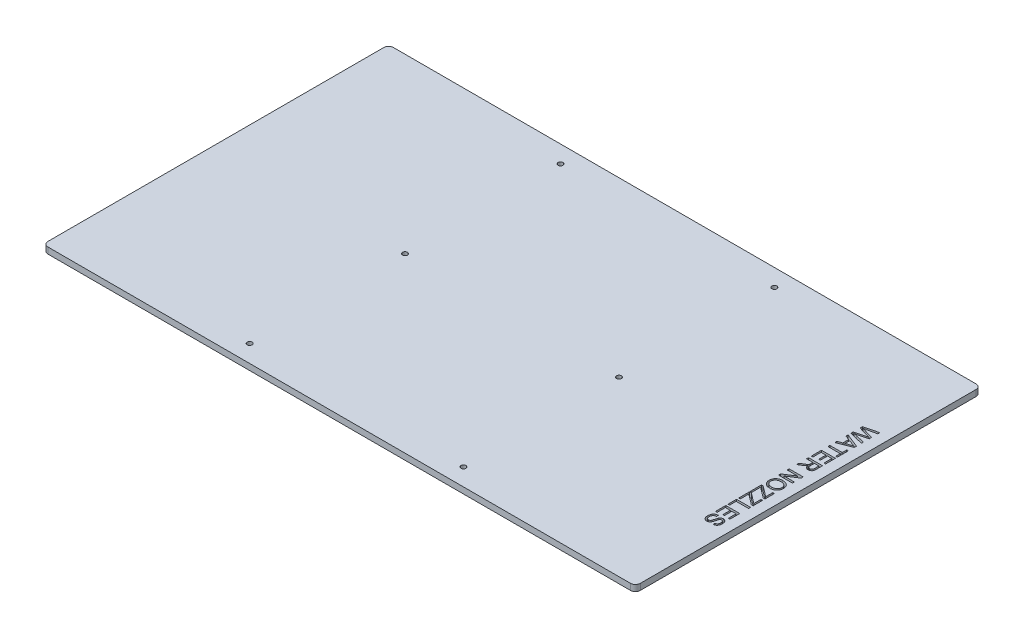
from build123d import *

# Parameters (mm, degrees)
SKETCH1_W           = 304.8
SKETCH1_H           = 177.8
SKETCH1_R           = 1.27
BOSS_EXTRUDE1_DEPTH = 3.175
CUT_EXTRUDE1_DEPTH  = 2.54
FILLET1_R           = 2.54


with BuildPart() as part:
    # Sketch1 → Boss-Extrude1 (new body)
    with BuildSketch(Plane(origin=(0, 0, 0), x_dir=(1, 0, 0), z_dir=(0, 1, 0))):
        Rectangle(SKETCH1_W, SKETCH1_H)
        with Locations((-55.0291, 80.01)):
            Circle(SKETCH1_R, mode=Mode.SUBTRACT)
        with Locations((-55.033333333, 0)):
            Circle(SKETCH1_R, mode=Mode.SUBTRACT)
        with Locations((-55.0291, -80.01)):
            Circle(SKETCH1_R, mode=Mode.SUBTRACT)
        with Locations((55.0291, -80.01)):
            Circle(SKETCH1_R, mode=Mode.SUBTRACT)
        with Locations((55.033333333, 0)):
            Circle(SKETCH1_R, mode=Mode.SUBTRACT)
        with Locations((55.0291, 80.01)):
            Circle(SKETCH1_R, mode=Mode.SUBTRACT)
    extrude(amount=BOSS_EXTRUDE1_DEPTH)

    # Sketch2 → Cut-Extrude1 (cut)
    # profile 1 of 12: a face of its own
    with BuildSketch(Plane(origin=(0, 3.175, 0), x_dir=(1, 0, 0), z_dir=(0, 1, 0))):
        with BuildLine():
            Line((139.7, 40.599397314), (146.891292318, 42.410185463))
            Line((146.891292318, 42.410185463), (146.891292318, 41.362895897))
            Line((146.891292318, 41.362895897), (142.161922791, 40.295438444))
            add(Edge.make_bspline(
                [(142.161922791, 40.295438444), (141.918010101, 40.240116159), (141.43267487, 40.130036385), (140.947069932, 40.021152573), (140.705513229, 39.966989996)],
                knots=[0, 0, 0, 0, 1.00513078, 2, 2, 2, 2], degree=3))
            add(Edge.make_bspline(
                [(140.705513229, 39.966989996), (140.792371041, 39.941345716), (140.956342762, 39.892933987), (141.188788479, 39.827490711), (141.391660637, 39.768050681), (141.565904996, 39.717410826), (141.711766359, 39.676407931), (141.82745239, 39.641006497), (141.915228597, 39.616877322), (141.963619911, 39.602578329), (141.983292933, 39.596765212)],
                knots=[0, 0, 0, 0, 1.633809233, 3.084334118, 4.356383392, 5.447555203, 6.357852567, 7.089694452, 7.629924063, 8, 8, 8, 8], degree=3))
            Line((141.983292933, 39.596765212), (146.891292318, 38.176369734))
            Line((146.891292318, 38.176369734), (146.891292318, 36.956212564))
            Line((146.891292318, 36.956212564), (143.288443342, 35.929090885))
            add(Edge.make_bspline(
                [(143.288443342, 35.929090885), (143.065873463, 35.872408071), (142.627013829, 35.760641828), (141.973316149, 35.612142336), (141.335477306, 35.475082051), (140.913616359, 35.396132754), (140.705513229, 35.357187229)],
                knots=[0, 0, 0, 0, 1.04154457, 2.053700482, 3.039894486, 4, 4, 4, 4], degree=3))
            add(Edge.make_bspline(
                [(140.705513229, 35.357187229), (140.812108286, 35.333148364), (141.036323517, 35.282584298), (141.390339814, 35.203396852), (141.778206423, 35.11544733), (142.048588999, 35.054626897), (142.189293495, 35.022976528)],
                knots=[0, 0, 0, 0, 0.862132589, 1.813435466, 2.862132822, 4, 4, 4, 4], degree=3))
            Line((142.189293495, 35.022976528), (146.891292318, 33.961281328))
            Line((146.891292318, 33.961281328), (146.891292318, 32.913991762))
            Line((146.891292318, 32.913991762), (139.7, 34.726220475))
            Line((139.7, 34.726220475), (139.7, 35.841216519))
            Line((139.7, 35.841216519), (145.195749237, 37.343724109))
            add(Edge.make_bspline(
                [(145.195749237, 37.343724109), (145.249475294, 37.35881145), (145.351534795, 37.387471778), (145.497177163, 37.425038757), (145.625263633, 37.462292796), (145.737449513, 37.491924711), (145.832604318, 37.517568652), (145.910449451, 37.540277459), (145.972508465, 37.554883152), (146.007780963, 37.565445312), (146.022632609, 37.569892557)],
                knots=[0, 0, 0, 0, 1.562239628, 2.967673567, 4.210417925, 5.296319877, 6.215971374, 6.969386481, 7.566055473, 8, 8, 8, 8], degree=3))
            add(Edge.make_bspline(
                [(146.022632609, 37.569892557), (145.928450634, 37.596558009), (145.750492988, 37.646942608), (145.499965869, 37.721559871), (145.2796766, 37.784171595), (145.143390879, 37.823850077), (145.080504168, 37.842159033)],
                knots=[0, 0, 0, 0, 1.197730334, 2.263121701, 3.198547257, 4, 4, 4, 4], degree=3))
            Line((145.080504168, 37.842159033), (139.7, 39.399408031))
            Line((139.7, 39.399408031), (139.7, 40.599397314))
        make_face()
    # profile 2 of 12: a face of its own
    with BuildSketch(Plane(origin=(0, 3.175, 0), x_dir=(1, 0, 0), z_dir=(0, 1, 0))):
        Polygon((139.7, 33.252524153), (146.891292318, 30.397327563), (146.891292318, 29.253520252), (139.7, 26.398323662), (139.7, 27.474424496), (141.912705329, 28.292664487), (141.912705329, 31.358183328), (139.7, 32.176423319), align=None)
        with BuildLine():
            Line((142.742469827, 31.052783894), (142.742469827, 28.598063921))
            Line((142.742469827, 28.598063921), (144.632488962, 29.296737152))
            add(Edge.make_bspline(
                [(144.632488962, 29.296737152), (144.705516725, 29.32352179), (144.848299792, 29.375890813), (145.055751534, 29.453988804), (145.252756224, 29.52533787), (145.436489095, 29.595301488), (145.609619053, 29.658458896), (145.770976683, 29.716672698), (145.919440472, 29.774245656), (146.015363377, 29.808795999), (146.06152782, 29.825423907)],
                knots=[0, 0, 0, 0, 1.225184869, 2.395467751, 3.491410812, 4.525364584, 5.492066482, 6.394148129, 7.227157926, 8, 8, 8, 8], degree=3))
            add(Edge.make_bspline(
                [(146.06152782, 29.825423907), (145.947690369, 29.852929678), (145.71954608, 29.908054634), (145.385284092, 30.02347287), (145.05407908, 30.155507323), (144.840652831, 30.262735032), (144.733328397, 30.316656015)],
                knots=[0, 0, 0, 0, 0.9891762, 1.982431084, 2.985436691, 4, 4, 4, 4], degree=3))
            Line((144.733328397, 30.316656015), (142.742469827, 31.052783894))
        make_face(mode=Mode.SUBTRACT)
    # profile 3 of 12: a face of its own
    with BuildSketch(Plane(origin=(0, 3.175, 0), x_dir=(1, 0, 0), z_dir=(0, 1, 0))):
        Polygon((139.7, 23.878778337), (146.06152782, 23.878778337), (146.06152782, 26.183679721), (146.891292318, 26.183679721), (146.891292318, 20.559720344), (146.06152782, 20.559720344), (146.06152782, 22.864621728), (139.7, 22.864621728), align=None)
    # profile 4 of 12: a face of its own
    with BuildSketch(Plane(origin=(0, 3.175, 0), x_dir=(1, 0, 0), z_dir=(0, 1, 0))):
        Polygon((139.7, 19.545563735), (146.891292318, 19.545563735), (146.891292318, 14.474780691), (146.06152782, 14.474780691), (146.06152782, 18.531407126), (143.848822491, 18.531407126), (143.848822491, 14.751368857), (143.019057993, 14.751368857), (143.019057993, 18.531407126), (140.529764498, 18.531407126), (140.529764498, 14.29038858), (139.7, 14.29038858), align=None)
    # profile 5 of 12: a face of its own
    with BuildSketch(Plane(origin=(0, 3.175, 0), x_dir=(1, 0, 0), z_dir=(0, 1, 0))):
        with BuildLine():
            Line((139.7, 12.90744775), (146.891292318, 12.90744775))
            Line((146.891292318, 12.90744775), (146.891292318, 9.787187501))
            add(Edge.make_bspline(
                [(146.891292318, 9.787187501), (146.890719358, 9.713714577), (146.88961046, 9.571516331), (146.881686545, 9.365305218), (146.864852182, 9.173282605), (146.846050259, 8.99423828), (146.818288848, 8.828478621), (146.785719716, 8.675924614), (146.747226755, 8.537161395), (146.70172659, 8.41113294), (146.65026646, 8.294196999), (146.586739284, 8.185835298), (146.517241888, 8.081403532), (146.434932223, 7.98503292), (146.346427046, 7.89250504), (146.247351056, 7.806981757), (146.139103449, 7.728045686), (145.984348252, 7.630645623), (145.777192572, 7.528158567), (145.513452672, 7.440686114), (145.236989629, 7.384760592), (145.048120631, 7.378739403), (144.952294029, 7.375684428)],
                knots=[0, 0, 0, 0, 1.242122331, 2.403982386, 3.487329914, 4.500326623, 5.446523787, 6.327028739, 7.136568587, 7.878666205, 8.590811102, 9.292609518, 9.999600102, 10.708452415, 11.431798422, 12.162621657, 12.917616336, 13.694634159, 15.252079616, 16.810286496, 18.381632726, 20, 20, 20, 20], degree=3))
            add(Edge.make_bspline(
                [(144.952294029, 7.375684428), (144.890778569, 7.37709165), (144.769281319, 7.379871008), (144.590647648, 7.401160869), (144.419971093, 7.439683966), (144.255753461, 7.48907958), (144.100333994, 7.556697048), (143.950491545, 7.63499364), (143.810516278, 7.732126935), (143.675747631, 7.84058847), (143.552200949, 7.966682451), (143.438215685, 8.107045246), (143.339735409, 8.265209511), (143.25123324, 8.438264749), (143.173787754, 8.626524977), (143.10867237, 8.83124209), (143.057693754, 9.051691208), (143.032157635, 9.204567236), (143.019057993, 9.282990324)],
                knots=[0, 0, 0, 0, 0.98268397, 1.940868231, 2.867803148, 3.77529712, 4.675825539, 5.571570676, 6.471608834, 7.392971743, 8.331421822, 9.286283743, 10.275919943, 11.301762849, 12.388744527, 13.524158817, 14.729930953, 16, 16, 16, 16], degree=3))
            add(Edge.make_bspline(
                [(143.019057993, 9.282990324), (142.989925812, 9.2250232), (142.934789019, 9.115312181), (142.846271077, 8.963984742), (142.758672467, 8.834036947), (142.694617331, 8.759083356), (142.664679405, 8.724051738)],
                knots=[0, 0, 0, 0, 1.172410807, 2.218954047, 3.167579294, 4, 4, 4, 4], degree=3))
            add(Edge.make_bspline(
                [(142.664679405, 8.724051738), (142.598176784, 8.65600296), (142.46179086, 8.516446123), (142.2273313, 8.326002591), (141.969492889, 8.137560987), (141.78160129, 8.024424583), (141.685096317, 7.966315408)],
                knots=[0, 0, 0, 0, 0.918170575, 1.883016652, 2.912673989, 4, 4, 4, 4], degree=3))
            Line((141.685096317, 7.966315408), (139.7, 6.786494012))
            Line((139.7, 6.786494012), (139.7, 7.949028648))
            Line((139.7, 7.949028648), (141.218353787, 8.845059061))
            add(Edge.make_bspline(
                [(141.218353787, 8.845059061), (141.271626158, 8.877277139), (141.374859267, 8.939710486), (141.525640959, 9.0298715), (141.664406238, 9.11835134), (141.795360764, 9.200146835), (141.915099613, 9.2796333), (142.027194869, 9.352347094), (142.127215347, 9.423882684), (142.247678565, 9.507079512), (142.378793463, 9.607385335), (142.51264314, 9.725227599), (142.621935013, 9.834572419), (142.727516561, 9.971377692), (142.8258971, 10.141134426), (142.871617982, 10.285131355), (142.89372898, 10.354769467)],
                knots=[0, 0, 0, 0, 1.130769053, 2.191244754, 3.190605808, 4.119719489, 4.995392299, 5.800890497, 6.546104885, 7.228445539, 8.4599972, 9.541354885, 10.466489475, 11.262010607, 12.675885558, 14, 14, 14, 14], degree=3))
            add(Edge.make_bspline(
                [(142.89372898, 10.354769467), (142.899000238, 10.383999999), (142.911034679, 10.450734181), (142.918894392, 10.564048654), (142.927236425, 10.701343041), (142.926993366, 10.800842622), (142.926861937, 10.854644955)],
                knots=[0, 0, 0, 0, 0.709978628, 1.620902492, 2.713552433, 4, 4, 4, 4], degree=3))
            Line((142.926861937, 10.854644955), (142.926861937, 11.893291141))
            Line((142.926861937, 11.893291141), (139.7, 11.893291141))
            Line((139.7, 11.893291141), (139.7, 12.90744775))
        make_face()
        with BuildLine():
            Line((143.756626436, 11.893291141), (143.756626436, 9.967257922))
            add(Edge.make_bspline(
                [(143.756626436, 9.967257922), (143.758143556, 9.870680588), (143.76097967, 9.690138321), (143.785027209, 9.437659887), (143.823660549, 9.222100977), (143.879107351, 9.039438161), (143.956434937, 8.886057448), (144.052511636, 8.754288984), (144.169411157, 8.642191056), (144.303830251, 8.550576168), (144.450495496, 8.478417995), (144.605647263, 8.429158458), (144.765929244, 8.394839629), (144.875280389, 8.391521992), (144.930685578, 8.389841037)],
                knots=[0, 0, 0, 0, 1.545806995, 2.889741191, 4.055176196, 5.047087691, 5.934047151, 6.79198357, 7.645535072, 8.5133672, 9.386595861, 10.252007348, 11.114340652, 12, 12, 12, 12], degree=3))
            add(Edge.make_bspline(
                [(144.930685578, 8.389841037), (144.971051349, 8.391179534), (145.050116036, 8.393801256), (145.166161046, 8.407545188), (145.276430627, 8.434266655), (145.381507679, 8.469552288), (145.480622586, 8.516701053), (145.574543379, 8.572711862), (145.662749512, 8.639550049), (145.745509673, 8.716109346), (145.820813333, 8.804013332), (145.885784057, 8.90442035), (145.940995157, 9.016538495), (145.984814377, 9.140498087), (146.01986262, 9.27590863), (146.043179085, 9.423540987), (146.060050802, 9.582720003), (146.061026282, 9.69302183), (146.06152782, 9.749732854)],
                knots=[0, 0, 0, 0, 0.965208469, 1.890559848, 2.786986821, 3.67262109, 4.535197034, 5.405224191, 6.282113641, 7.175449223, 8.095446547, 9.040936516, 10.026471658, 11.075712529, 12.17809725, 13.364958037, 14.645208957, 16, 16, 16, 16], degree=3))
            Line((146.06152782, 9.749732854), (146.06152782, 11.893291141))
            Line((146.06152782, 11.893291141), (143.756626436, 11.893291141))
        make_face(mode=Mode.SUBTRACT)
    # profile 6 of 12: a face of its own
    with BuildSketch(Plane(origin=(0, 3.175, 0), x_dir=(1, 0, 0), z_dir=(0, 1, 0))):
        Polygon((139.7, 2.950273771), (146.891292318, 2.950273771), (146.891292318, 1.878494628), (141.525193783, -1.567332941), (146.891292318, -1.567332941), (146.891292318, -2.58148955), (139.7, -2.58148955), (139.7, -1.509710406), (145.066098534, 1.936117162), (139.7, 1.936117162), align=None)
    # profile 7 of 12: a face of its own
    with BuildSketch(Plane(origin=(0, 3.175, 0), x_dir=(1, 0, 0), z_dir=(0, 1, 0))):
        with BuildLine():
            add(Edge.make_bspline(
                [(143.200568977, -3.872234325), (143.344742891, -3.874750601), (143.625658451, -3.879653438), (144.034795943, -3.92492341), (144.419281361, -3.999605887), (144.780893264, -4.102339363), (145.116904413, -4.238978276), (145.431446648, -4.401107285), (145.719045321, -4.597822571), (145.983025744, -4.820098076), (146.216382386, -5.068437708), (146.42364216, -5.332831608), (146.59651991, -5.61660193), (146.739260307, -5.917121453), (146.848852157, -6.235668389), (146.925576448, -6.57134797), (146.975071065, -6.923801293), (146.98064185, -7.164711385), (146.983488373, -7.287810063)],
                knots=[0, 0, 0, 0, 1.203593535, 2.345140965, 3.431924157, 4.471254512, 5.478692091, 6.45615896, 7.42038538, 8.382007041, 9.33218277, 10.260966195, 11.182476517, 12.100814648, 13.034113903, 13.98924309, 14.972556454, 16, 16, 16, 16], degree=3))
            add(Edge.make_bspline(
                [(146.983488373, -7.287810063), (146.982083246, -7.369004565), (146.979292919, -7.530242159), (146.957643942, -7.769046914), (146.920039242, -8.001421819), (146.86778006, -8.227532904), (146.801835233, -8.447603788), (146.721044891, -8.662083881), (146.623835099, -8.869598947), (146.513808435, -9.070695723), (146.389328101, -9.262238692), (146.254649039, -9.444049022), (146.106799681, -9.613148244), (145.947920566, -9.77054561), (145.777938945, -9.9165831), (145.594741796, -10.049441633), (145.401125111, -10.171807619), (145.195584993, -10.28104651), (144.982240572, -10.3788984), (144.760014789, -10.462484041), (144.531625728, -10.534270472), (144.295707331, -10.594358298), (144.052344136, -10.637473782), (143.802583707, -10.671806857), (143.545610036, -10.689877354), (143.372019731, -10.693107052), (143.284121652, -10.694742421)],
                knots=[0, 0, 0, 0, 1.034309052, 2.053950705, 3.051627699, 4.031038476, 5.008402854, 5.97643726, 6.948041091, 7.925482047, 8.894385902, 9.856059247, 10.805611944, 11.752954998, 12.703138077, 13.657545741, 14.63347317, 15.618750787, 16.620694897, 17.621667406, 18.641309059, 19.669521506, 20.720627516, 21.788266251, 22.880080611, 24, 24, 24, 24], degree=3))
            add(Edge.make_bspline(
                [(143.284121652, -10.694742421), (143.194774132, -10.693244066), (143.018252702, -10.690283806), (142.75747654, -10.670253479), (142.504186722, -10.635033201), (142.257627978, -10.588319503), (142.018313612, -10.525724559), (141.78555742, -10.451340137), (141.560746026, -10.361367792), (141.343336543, -10.259754686), (141.136322927, -10.144777048), (140.941138804, -10.017957762), (140.759660471, -9.879166874), (140.589476659, -9.7306586), (140.434565882, -9.56868993), (140.290383421, -9.3967376), (140.161526545, -9.211921943), (140.044348478, -9.017795627), (139.943626094, -8.815008266), (139.85320227, -8.608118694), (139.77713015, -8.396879802), (139.714892871, -8.181819365), (139.667370015, -7.96275636), (139.63270603, -7.740089103), (139.612261458, -7.512920576), (139.609297418, -7.360358764), (139.607803945, -7.283488373)],
                knots=[0, 0, 0, 0, 1.141388526, 2.255009839, 3.338557341, 4.406873761, 5.458773361, 6.496627797, 7.526383469, 8.5499449, 9.560445588, 10.548978906, 11.520676971, 12.476877461, 13.431305422, 14.380871584, 15.340724931, 16.306479833, 17.274880643, 18.230982746, 19.189541512, 20.140849708, 21.088988189, 22.051132196, 23.018035844, 24, 24, 24, 24], degree=3))
            add(Edge.make_bspline(
                [(139.607803945, -7.283488373), (139.609026868, -7.200837462), (139.611449174, -7.037126706), (139.635624736, -6.795157068), (139.672512416, -6.559210096), (139.725741713, -6.329958393), (139.795273652, -6.107764179), (139.878947671, -5.892589322), (139.977210681, -5.683912211), (140.091114191, -5.483159574), (140.216853762, -5.290518027), (140.356042488, -5.109892863), (140.505615144, -4.940767394), (140.667824314, -4.78521722), (140.839585734, -4.640794425), (141.022012391, -4.507224855), (141.216181233, -4.386540322), (141.421009429, -4.27937035), (141.631310907, -4.18273359), (141.84697264, -4.101270405), (142.064864534, -4.029692273), (142.286316752, -3.972684518), (142.51082187, -3.927257082), (142.738005404, -3.896710233), (142.968205951, -3.87464912), (143.122724858, -3.873043307), (143.200568977, -3.872234325)],
                knots=[0, 0, 0, 0, 1.072763531, 2.124875893, 3.153923666, 4.171672792, 5.177320289, 6.174136357, 7.166947757, 8.169130198, 9.168574722, 10.151174515, 11.127106349, 12.097106019, 13.066163601, 14.038804255, 15.030068075, 16.031241659, 17.038395341, 18.032966873, 19.022680693, 20.014630449, 21.000093848, 21.9946263, 22.989725266, 24, 24, 24, 24], degree=3))
        make_face()
        with BuildLine():
            add(Edge.make_bspline(
                [(143.18904447, -4.886390934), (143.085221971, -4.8879442), (142.882775424, -4.890972961), (142.587626766, -4.925655463), (142.309110467, -4.978218734), (142.04657521, -5.050883677), (141.801950955, -5.147900238), (141.574767951, -5.266514417), (141.363952405, -5.405651782), (141.171893417, -5.565239122), (140.999302669, -5.740590433), (140.848487893, -5.927974178), (140.722728679, -6.127216277), (140.6176871, -6.335678791), (140.536752949, -6.556125666), (140.479539754, -6.78750075), (140.443827808, -7.029799504), (140.439680892, -7.195008701), (140.437568443, -7.279166683)],
                knots=[0, 0, 0, 0, 1.215616022, 2.370365452, 3.475740397, 4.533490648, 5.5560781, 6.552384115, 7.530550651, 8.509299237, 9.471863928, 10.40830403, 11.321168121, 12.226759389, 13.137923578, 14.065605683, 15.014614662, 16, 16, 16, 16], degree=3))
            add(Edge.make_bspline(
                [(140.437568443, -7.279166683), (140.439710612, -7.364751904), (140.443904973, -7.532327525), (140.479014467, -7.778268523), (140.538786878, -8.011940024), (140.618357524, -8.235658031), (140.725923367, -8.445378297), (140.851882769, -8.646004235), (141.005800048, -8.832071834), (141.178701115, -9.008128732), (141.375212877, -9.166098945), (141.590597748, -9.306038803), (141.827532292, -9.420500369), (142.082609039, -9.515981831), (142.357428744, -9.590879144), (142.651988993, -9.643239378), (142.965513323, -9.675529508), (143.180800424, -9.678870576), (143.291324469, -9.680585812)],
                knots=[0, 0, 0, 0, 0.976909331, 1.912785716, 2.828990727, 3.727421029, 4.617481149, 5.514840137, 6.426786422, 7.368873452, 8.327895072, 9.299698503, 10.295216142, 11.325792517, 12.405818789, 13.542541501, 14.738390493, 16, 16, 16, 16], degree=3))
            add(Edge.make_bspline(
                [(143.291324469, -9.680585812), (143.362425152, -9.679973492), (143.501898963, -9.678772341), (143.70748495, -9.662865064), (143.906676055, -9.642346743), (144.099215164, -9.611107188), (144.284305234, -9.568055435), (144.46335426, -9.520360321), (144.634823252, -9.460723284), (144.799370302, -9.39304249), (144.956202525, -9.317360319), (145.103810699, -9.231814906), (145.242544392, -9.138069923), (145.372016781, -9.035938503), (145.492498367, -8.925780008), (145.603699761, -8.807282133), (145.706272053, -8.680155085), (145.799327504, -8.545135144), (145.883147711, -8.404352342), (145.954806581, -8.258012949), (146.018195963, -8.108144741), (146.065615012, -7.952681798), (146.10534388, -7.794141201), (146.134617552, -7.631591409), (146.149998026, -7.463860061), (146.152473006, -7.350742518), (146.153723875, -7.293572317)],
                knots=[0, 0, 0, 0, 1.220471707, 2.394123819, 3.538599016, 4.658184489, 5.740257119, 6.800339203, 7.838063059, 8.854709651, 9.853990799, 10.825506309, 11.781362566, 12.726491381, 13.654344845, 14.581758638, 15.513997413, 16.45624495, 17.395131889, 18.32430312, 19.252156584, 20.185670527, 21.111507116, 22.057642305, 23.018322208, 24, 24, 24, 24], degree=3))
            add(Edge.make_bspline(
                [(146.153723875, -7.293572317), (146.152077995, -7.21277849), (146.148820798, -7.052887511), (146.114128055, -6.81808813), (146.060877956, -6.5919658), (145.987756036, -6.374110973), (145.889798934, -6.165720828), (145.771818286, -5.965413326), (145.632145804, -5.774112058), (145.47246777, -5.591935999), (145.288171775, -5.422171447), (145.07105564, -5.278564966), (144.826119231, -5.157554337), (144.55403582, -5.056505561), (144.252683068, -4.979460811), (143.923362322, -4.926212708), (143.565725227, -4.892593093), (143.317814674, -4.888511173), (143.18904447, -4.886390934)],
                knots=[0, 0, 0, 0, 0.895069985, 1.771343461, 2.624796936, 3.468163849, 4.31361133, 5.172690577, 6.041527277, 6.935393444, 7.854933085, 8.810158187, 9.810009302, 10.877887247, 12.021813459, 13.252239476, 14.572752642, 16, 16, 16, 16], degree=3))
        make_face(mode=Mode.SUBTRACT)
    # profile 8 of 12: a face of its own
    with BuildSketch(Plane(origin=(0, 3.175, 0), x_dir=(1, 0, 0), z_dir=(0, 1, 0))):
        with BuildLine():
            Line((139.7, -11.340114809), (140.564338019, -11.340114809))
            Line((140.564338019, -11.340114809), (145.236085011, -14.88101956))
            add(Edge.make_bspline(
                [(145.236085011, -14.88101956), (145.314721794, -14.94119326), (145.465510402, -15.056578301), (145.683391248, -15.219549317), (145.87842203, -15.370205961), (146.002848792, -15.46361391), (146.06152782, -15.507664623)],
                knots=[0, 0, 0, 0, 1.146521337, 2.198492228, 3.150418105, 4, 4, 4, 4], degree=3))
            Line((146.06152782, -15.507664623), (146.06152782, -11.801095085))
            Line((146.06152782, -11.801095085), (146.891292318, -11.801095085))
            Line((146.891292318, -11.801095085), (146.891292318, -16.779682075))
            Line((146.891292318, -16.779682075), (146.06152782, -16.779682075))
            Line((146.06152782, -16.779682075), (140.992185338, -12.93769958))
            Line((140.992185338, -12.93769958), (140.529764498, -12.587642683))
            Line((140.529764498, -12.587642683), (140.529764498, -16.964074185))
            Line((140.529764498, -16.964074185), (139.7, -16.964074185))
            Line((139.7, -16.964074185), (139.7, -11.340114809))
        make_face()
    # profile 9 of 12: a face of its own
    with BuildSketch(Plane(origin=(0, 3.175, 0), x_dir=(1, 0, 0), z_dir=(0, 1, 0))):
        with BuildLine():
            Line((139.7, -17.425054462), (140.564338019, -17.425054462))
            Line((140.564338019, -17.425054462), (145.236085011, -20.965959213))
            add(Edge.make_bspline(
                [(145.236085011, -20.965959213), (145.314721794, -21.026132913), (145.465510402, -21.141517954), (145.683391248, -21.304488971), (145.87842203, -21.455145614), (146.002848792, -21.548553563), (146.06152782, -21.592604277)],
                knots=[0, 0, 0, 0, 1.146521337, 2.198492228, 3.150418105, 4, 4, 4, 4], degree=3))
            Line((146.06152782, -21.592604277), (146.06152782, -17.886034739))
            Line((146.06152782, -17.886034739), (146.891292318, -17.886034739))
            Line((146.891292318, -17.886034739), (146.891292318, -22.864621728))
            Line((146.891292318, -22.864621728), (146.06152782, -22.864621728))
            Line((146.06152782, -22.864621728), (140.992185338, -19.022639234))
            Line((140.992185338, -19.022639234), (140.529764498, -18.672582336))
            Line((140.529764498, -18.672582336), (140.529764498, -23.049013839))
            Line((140.529764498, -23.049013839), (139.7, -23.049013839))
            Line((139.7, -23.049013839), (139.7, -17.425054462))
        make_face()
    # profile 10 of 12: a face of its own
    with BuildSketch(Plane(origin=(0, 3.175, 0), x_dir=(1, 0, 0), z_dir=(0, 1, 0))):
        Polygon((139.7, -24.155366503), (146.891292318, -24.155366503), (146.891292318, -25.169523112), (140.529764498, -25.169523112), (140.529764498, -28.58077716), (139.7, -28.58077716), align=None)
    # profile 11 of 12: a face of its own
    with BuildSketch(Plane(origin=(0, 3.175, 0), x_dir=(1, 0, 0), z_dir=(0, 1, 0))):
        Polygon((139.7, -29.687129824), (146.891292318, -29.687129824), (146.891292318, -34.757912869), (146.06152782, -34.757912869), (146.06152782, -30.701286433), (143.848822491, -30.701286433), (143.848822491, -34.481324703), (143.019057993, -34.481324703), (143.019057993, -30.701286433), (140.529764498, -30.701286433), (140.529764498, -34.94230498), (139.7, -34.94230498), align=None)
    # profile 12 of 12: a face of its own
    with BuildSketch(Plane(origin=(0, 3.175, 0), x_dir=(1, 0, 0), z_dir=(0, 1, 0))):
        with BuildLine():
            Line((142.189293495, -35.956461589), (142.189293495, -36.970618197))
            add(Edge.make_bspline(
                [(142.189293495, -36.970618197), (142.098227577, -36.981757345), (141.923285047, -37.003156248), (141.675467459, -37.063286959), (141.451963587, -37.139758907), (141.252486254, -37.238292352), (141.074677214, -37.362432817), (140.916258038, -37.515197516), (140.777816883, -37.700138648), (140.656535096, -37.909646089), (140.559052, -38.141549993), (140.488167215, -38.389514826), (140.445784262, -38.652224335), (140.440345542, -38.832149429), (140.437568443, -38.92402212)],
                knots=[0, 0, 0, 0, 1.125661535, 2.162456423, 3.124646671, 4.021152204, 4.884793578, 5.777140414, 6.711097021, 7.712275503, 8.742730725, 9.791526725, 10.872317486, 12, 12, 12, 12], degree=3))
            add(Edge.make_bspline(
                [(140.437568443, -38.92402212), (140.439031704, -39.005324382), (140.44187622, -39.163372363), (140.477596268, -39.392598366), (140.527064736, -39.608441268), (140.602381616, -39.806959012), (140.695683221, -39.985963316), (140.80465797, -40.143354697), (140.932051158, -40.275186614), (141.073239919, -40.381340298), (141.223020959, -40.463802138), (141.377580062, -40.521272708), (141.533862437, -40.559970312), (141.639737395, -40.564176293), (141.692299134, -40.566264356)],
                knots=[0, 0, 0, 0, 1.267278989, 2.463534024, 3.612003651, 4.716903637, 5.765847919, 6.755281273, 7.693132489, 8.613187884, 9.50174055, 10.350585091, 11.181146174, 12, 12, 12, 12], degree=3))
            add(Edge.make_bspline(
                [(141.692299134, -40.566264356), (141.744337033, -40.564042154), (141.846149516, -40.559694401), (141.993229654, -40.525872371), (142.129589529, -40.469897461), (142.257456647, -40.392906632), (142.375516476, -40.287016906), (142.482170153, -40.151797624), (142.581694742, -39.987880384), (142.634997726, -39.864993089), (142.663238842, -39.799884646)],
                knots=[0, 0, 0, 0, 0.942390321, 1.843792698, 2.718029279, 3.604523015, 4.535311134, 5.574971969, 6.71516581, 8, 8, 8, 8], degree=3))
            add(Edge.make_bspline(
                [(142.663238842, -39.799884646), (142.673635955, -39.774549477), (142.697124923, -39.717312728), (142.728211504, -39.61920907), (142.768457767, -39.502809969), (142.809553502, -39.365687357), (142.854188881, -39.208036582), (142.902652909, -39.030219196), (142.956268911, -38.83246571), (143.012013971, -38.620457867), (143.069092289, -38.406013153), (143.126527692, -38.200751645), (143.183956445, -38.011604901), (143.240087198, -37.837555112), (143.296108725, -37.679613943), (143.350872692, -37.536970588), (143.403210454, -37.409429631), (143.441695304, -37.331532911), (143.459870382, -37.294744955)],
                knots=[0, 0, 0, 0, 0.499203687, 1.127791816, 1.87544445, 2.745218927, 3.737540508, 4.863437871, 6.106074846, 7.473929386, 8.860961239, 10.152791525, 11.360569269, 12.465464948, 13.48744072, 14.416013254, 15.251937243, 16, 16, 16, 16], degree=3))
            add(Edge.make_bspline(
                [(143.459870382, -37.294744955), (143.505623048, -37.210133689), (143.593937601, -37.046811926), (143.751163746, -36.826838811), (143.927308225, -36.643060923), (144.118845767, -36.492938182), (144.325275365, -36.37607482), (144.544730043, -36.294560307), (144.77540831, -36.24082041), (144.933741398, -36.235668829), (145.014238253, -36.233049755)],
                knots=[0, 0, 0, 0, 1.158753891, 2.236696577, 3.247844099, 4.216965963, 5.160353944, 6.094570301, 7.031275781, 8, 8, 8, 8], degree=3))
            add(Edge.make_bspline(
                [(145.014238253, -36.233049755), (145.103396921, -36.236463302), (145.280732865, -36.243252823), (145.540872551, -36.303775552), (145.791775547, -36.399659187), (145.989827633, -36.51112498), (146.140452636, -36.617968569), (146.24876493, -36.706588875), (146.348298702, -36.806008261), (146.442474176, -36.911877453), (146.52761287, -37.028786695), (146.606678461, -37.15309709), (146.67752327, -37.287393179), (146.76389859, -37.477525303), (146.852455254, -37.730417697), (146.929180236, -38.048830276), (146.974094122, -38.383972532), (146.980312663, -38.61272555), (146.983488373, -38.729546066)],
                knots=[0, 0, 0, 0, 1.2001067, 2.387003517, 3.579163215, 4.810460134, 5.437089112, 6.066784591, 6.693680817, 7.331043701, 7.974292474, 8.640345033, 9.314862782, 10.018578828, 11.453312207, 12.917685044, 14.425910937, 16, 16, 16, 16], degree=3))
            add(Edge.make_bspline(
                [(146.983488373, -38.729546066), (146.98060003, -38.857420886), (146.974986626, -39.105941625), (146.927025725, -39.46762655), (146.846144952, -39.805204568), (146.754621517, -40.070252392), (146.662266515, -40.265896705), (146.590187472, -40.404884772), (146.506855035, -40.533893545), (146.416676094, -40.654085404), (146.319689217, -40.766569316), (146.21360136, -40.868482392), (146.101979476, -40.964143518), (145.942128649, -41.07682639), (145.72893327, -41.195650126), (145.455713009, -41.303923255), (145.16477571, -41.372481181), (144.964647565, -41.388096175), (144.8629791, -41.396028855)],
                knots=[0, 0, 0, 0, 1.607767564, 3.124646298, 4.577694013, 5.968230118, 6.64098443, 7.297468537, 7.935727887, 8.569831019, 9.186231226, 9.801209789, 10.418260488, 11.033239051, 12.257996117, 13.47812891, 14.718847046, 16, 16, 16, 16], degree=3))
            Line((144.8629791, -41.396028855), (144.8629791, -40.381872246))
            add(Edge.make_bspline(
                [(144.8629791, -40.381872246), (144.914525152, -40.375640591), (145.015489235, -40.363434548), (145.160585877, -40.329181339), (145.296895335, -40.288245811), (145.422777496, -40.236062187), (145.539379887, -40.174418579), (145.644406276, -40.099743281), (145.741911683, -40.017896579), (145.829209147, -39.924784264), (145.905892271, -39.820234025), (145.972322456, -39.704170215), (146.028477465, -39.576629878), (146.074459997, -39.437659639), (146.110115899, -39.287250812), (146.136344264, -39.125055841), (146.149777166, -38.951139003), (146.152385133, -38.831365119), (146.153723875, -38.76988184)],
                knots=[0, 0, 0, 0, 1.074597235, 2.104830896, 3.08320792, 4.01963776, 4.922947153, 5.808618242, 6.683501764, 7.556007728, 8.44518997, 9.363001905, 10.32032511, 11.326760392, 12.390579697, 13.518793479, 14.726327422, 16, 16, 16, 16], degree=3))
            add(Edge.make_bspline(
                [(146.153723875, -38.76988184), (146.153242696, -38.705972623), (146.152311252, -38.582260096), (146.135305996, -38.403423248), (146.112008952, -38.237651492), (146.077524005, -38.085287793), (146.032908805, -37.947055563), (145.980175443, -37.821112723), (145.914664236, -37.710081222), (145.841349306, -37.611308695), (145.759438373, -37.526611248), (145.675510216, -37.451159024), (145.585990201, -37.388913723), (145.493846569, -37.335456359), (145.395126212, -37.29776974), (145.294119688, -37.268273821), (145.188699933, -37.250319392), (145.117067801, -37.248258379), (145.080504168, -37.247206364)],
                knots=[0, 0, 0, 0, 1.464643987, 2.835190547, 4.115048982, 5.300866033, 6.411522794, 7.442255218, 8.424145068, 9.359957701, 10.255529779, 11.121374133, 11.943044406, 12.751479056, 13.556984722, 14.358492815, 15.162115312, 16, 16, 16, 16], degree=3))
            add(Edge.make_bspline(
                [(145.080504168, -37.247206364), (145.01863345, -37.249827183), (144.898548091, -37.254913952), (144.727942994, -37.306857298), (144.572425394, -37.386746529), (144.487809062, -37.46545015), (144.445215724, -37.505067206)],
                knots=[0, 0, 0, 0, 1.050964922, 2.039826012, 3.013306874, 4, 4, 4, 4], degree=3))
            add(Edge.make_bspline(
                [(144.445215724, -37.505067206), (144.423929608, -37.530041374), (144.376856676, -37.585270206), (144.314561257, -37.688031986), (144.251619181, -37.815441223), (144.189052223, -37.968349964), (144.12608776, -38.14649181), (144.061306532, -38.349594379), (143.996627982, -38.57881285), (143.935337661, -38.8265667), (143.872301749, -39.07647453), (143.810549238, -39.313746016), (143.751698246, -39.531962053), (143.694350717, -39.73039605), (143.638603387, -39.90923685), (143.583303603, -40.067866774), (143.532441227, -40.207568312), (143.496655487, -40.29315203), (143.48003827, -40.332893091)],
                knots=[0, 0, 0, 0, 0.523891657, 1.158554055, 1.913784378, 2.794767528, 3.797522645, 4.933640231, 6.202082727, 7.603978424, 9.013314845, 10.322177672, 11.523239011, 12.626145434, 13.623952425, 14.517289202, 15.3114987, 16, 16, 16, 16], degree=3))
            add(Edge.make_bspline(
                [(143.48003827, -40.332893091), (143.456200665, -40.384599637), (143.409411443, -40.486090922), (143.329494727, -40.629843092), (143.246621594, -40.764069125), (143.157821733, -40.887574131), (143.064922594, -41.001079951), (142.966861321, -41.103895701), (142.863327992, -41.195385156), (142.721289412, -41.303908777), (142.529500697, -41.415181345), (142.281657836, -41.510802434), (142.016850315, -41.570611546), (141.834272362, -41.577110695), (141.741278288, -41.580420965)],
                knots=[0, 0, 0, 0, 0.899337291, 1.765248388, 2.59684015, 3.3906421, 4.166844185, 4.912752363, 5.632941945, 6.347675468, 7.734877245, 9.118505574, 10.532342477, 12, 12, 12, 12], degree=3))
            add(Edge.make_bspline(
                [(141.741278288, -41.580420965), (141.647294493, -41.576667966), (141.460705423, -41.569217015), (141.185664504, -41.505061641), (140.919151389, -41.40427694), (140.707658551, -41.286081915), (140.546108758, -41.174351891), (140.42999415, -41.0804934), (140.322628501, -40.97640973), (140.220648249, -40.864663316), (140.126134124, -40.744386551), (140.039053943, -40.614565427), (139.958501207, -40.476570146), (139.860342982, -40.279516355), (139.757660158, -40.017796183), (139.67214938, -39.684417226), (139.616676423, -39.333076184), (139.610802309, -39.091823738), (139.607803945, -38.968679585)],
                knots=[0, 0, 0, 0, 1.197055466, 2.376552968, 3.581957237, 4.820753935, 5.454298064, 6.085440993, 6.72202542, 7.359198513, 8.013298489, 8.67051481, 9.351020706, 10.049282741, 11.476266879, 12.925760103, 14.430794493, 16, 16, 16, 16], degree=3))
            add(Edge.make_bspline(
                [(139.607803945, -38.968679585), (139.608469982, -38.890383529), (139.609778732, -38.736533456), (139.624868277, -38.511145505), (139.647360417, -38.29520848), (139.680173845, -38.089285872), (139.723876534, -37.892797237), (139.775031989, -37.70596567), (139.835883639, -37.528807978), (139.905943012, -37.361413528), (139.987910607, -37.20389291), (140.076102737, -37.053550828), (140.176873201, -36.913171473), (140.285662361, -36.780849601), (140.404624909, -36.657512962), (140.53315623, -36.54391707), (140.670523665, -36.438070055), (140.817054123, -36.341999298), (140.971012045, -36.256207986), (141.129762457, -36.179048126), (141.294470338, -36.114042164), (141.464299684, -36.061652945), (141.638114956, -36.017276792), (141.81736608, -35.986502916), (142.001490342, -35.963876938), (142.12632268, -35.958947972), (142.189293495, -35.956461589)],
                knots=[0, 0, 0, 0, 1.259794174, 2.475468585, 3.633483936, 4.752716887, 5.828920721, 6.87130154, 7.868357378, 8.841438305, 9.788394823, 10.72402761, 11.64389108, 12.56602382, 13.478685853, 14.398289622, 15.324106125, 16.267144882, 17.215109807, 18.158654996, 19.105737623, 20.061356657, 21.017194371, 21.990367343, 22.986254633, 24, 24, 24, 24], degree=3))
        make_face()
    extrude(amount=-CUT_EXTRUDE1_DEPTH, mode=Mode.SUBTRACT)

    # Fillet1
    fillet1_edges = [part.edges().sort_by_distance(p)[0] for p in [
        (152.4, 1.5875, -88.9),
        (152.4, 1.5875, 88.9),
        (-152.4, 1.5875, 88.9),
        (-152.4, 1.5875, -88.9),
    ]]
    fillet(fillet1_edges, radius=FILLET1_R)


solid = part.part
